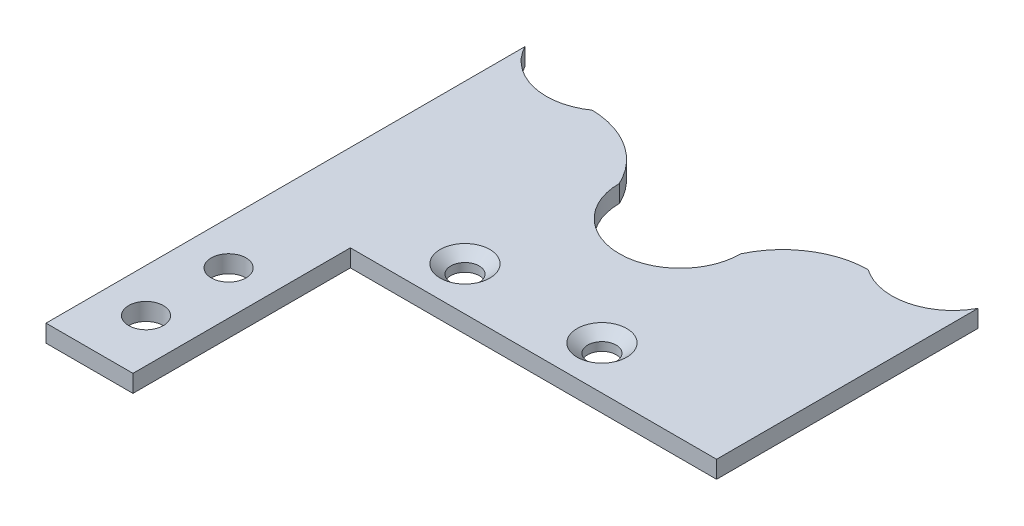
from build123d import *

# Parameters (mm, degrees)
BASE_FLANGE1_DEPTH                                = 2
SKETCH7_R                                         = 2
CUT_EXTRUDE1_DEPTH                                = 2
CSK_FOR_4_FLAT_HEAD_MACHINE_SCREW_100_D           = 3.2639
CSK_FOR_4_FLAT_HEAD_MACHINE_SCREW_100_DEPTH       = 2
CSK_FOR_4_FLAT_HEAD_MACHINE_SCREW_100_CSINK_D     = 5.715
CSK_FOR_4_FLAT_HEAD_MACHINE_SCREW_100_CSINK_ANGLE = 100
CSK_FOR_4_FLAT_HEAD_MACHINE_SCREW_100_TIP         = 0.980574487


# Sheet-metal steps are written as plain solids
with BuildPart() as part:
    # Sketch2 → Base-Flange1 (new body)
    with BuildSketch(Plane(origin=(0, 0, 0), x_dir=(1, 0, 0), z_dir=(0, 1, 0))):
        with BuildLine():
            Line((-26.055569119, -21.875), (-26.055569119, -46.875))
            Line((-26.055569119, -46.875), (-16.055569119, -46.875))
            Line((-16.055569119, -46.875), (-16.055569119, -21.875))
            Line((-16.055569119, -21.875), (26.055569119, -21.875))
            Line((26.055569119, -21.875), (26.055569119, 8.188046441))
            ThreePointArc((26.055569119, 8.188046441), (21.514872246, 4.669726518), (15.870079226, 5.73406431))
            ThreePointArc((15.870079226, 5.73406431), (10.616247764, 4.133629141), (7, 0))
            ThreePointArc((7, 0), (0, -7), (-7, 0))
            ThreePointArc((-7, 0), (-10.616247764, 4.133629141), (-15.870079226, 5.73406431))
            ThreePointArc((-15.870079226, 5.73406431), (-21.514872246, 4.669726518), (-26.055569119, 8.188046441))
            Line((-26.055569119, 8.188046441), (-26.055569119, -21.875))
        make_face()
    extrude(amount=-BASE_FLANGE1_DEPTH)

    # Sketch7 → Cut-Extrude1 (cut)
    with BuildSketch(Plane(origin=(0, 0, 0), x_dir=(1, 0, 0), z_dir=(0, 1, 0))):
        with Locations(Location((-21.055569119, -40.375, 0), (0, 0, 270))):
            Circle(SKETCH7_R)
        with Locations(Location((-21.055569119, -30.875, 0), (0, 0, 270))):
            Circle(SKETCH7_R)
    extrude(amount=-CUT_EXTRUDE1_DEPTH, mode=Mode.SUBTRACT)

    # CSK for #4 Flat Head Machine Screw (100)1
    with Locations(Plane(origin=(0, 0, 0), x_dir=(1, 0, 0), z_dir=(0, 1, 0))):
        with Locations((-7.875283017, -16.875), (7.875283017, -16.875)):
            CounterSinkHole(CSK_FOR_4_FLAT_HEAD_MACHINE_SCREW_100_D / 2, CSK_FOR_4_FLAT_HEAD_MACHINE_SCREW_100_CSINK_D / 2, depth=CSK_FOR_4_FLAT_HEAD_MACHINE_SCREW_100_DEPTH, counter_sink_angle=CSK_FOR_4_FLAT_HEAD_MACHINE_SCREW_100_CSINK_ANGLE)
            with Locations((0, 0, -(CSK_FOR_4_FLAT_HEAD_MACHINE_SCREW_100_DEPTH + CSK_FOR_4_FLAT_HEAD_MACHINE_SCREW_100_TIP / 2))):  # 118° drill point
                Cone(0, CSK_FOR_4_FLAT_HEAD_MACHINE_SCREW_100_D / 2, CSK_FOR_4_FLAT_HEAD_MACHINE_SCREW_100_TIP, mode=Mode.SUBTRACT)


solid = part.part
